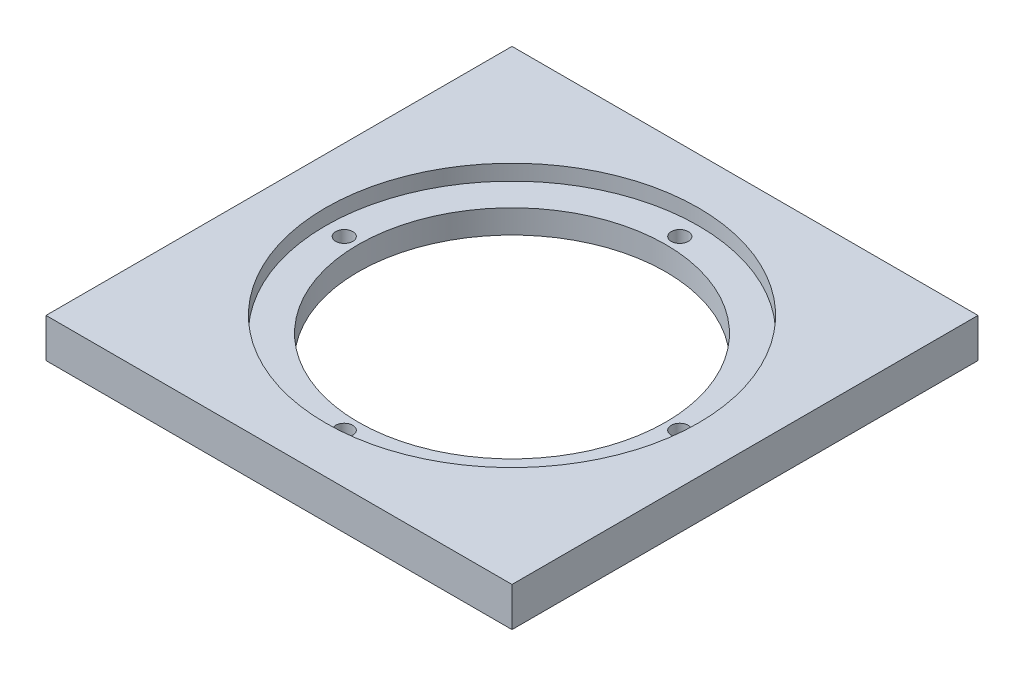
from build123d import *

# Parameters (mm, degrees)
SKETCH1_W               = 150
SKETCH1_H               = 150
SKETCH1_R               = 49.5
BOSS_EXTRUDE1_DEPTH     = 12.5984
SKETCH2_R               = 60
CUT_EXTRUDE1_DEPTH      = 5
CUT_EXTRUDE2_DEPTH      = 107.81160837
CUT_EXTRUDE2_DEPTH_BACK = 107.81160837
SKETCH3_R               = 2.75


with BuildPart() as part:
    # Sketch1 → Boss-Extrude1 (new body)
    with BuildSketch(Plane(origin=(0, 0, 0), x_dir=(1, 0, 0), z_dir=(0, 1, 0))):
        Rectangle(SKETCH1_W, SKETCH1_H)
        Circle(SKETCH1_R, mode=Mode.SUBTRACT)
    extrude(amount=-BOSS_EXTRUDE1_DEPTH)

    # Sketch2 → Cut-Extrude1 (cut)
    with BuildSketch(Plane(origin=(0, 0, 0), x_dir=(1, 0, 0), z_dir=(0, 1, 0))):
        Circle(SKETCH2_R)
    extrude(amount=-CUT_EXTRUDE1_DEPTH, mode=Mode.SUBTRACT)

    # Sketch3 → Cut-Extrude2 (cut, two sides: drawn at the far end of the back side and taken through both)
    with BuildSketch(Plane(origin=(0, 0, 0), x_dir=(1, 0, 0), z_dir=(0, 1, 0)).offset(-CUT_EXTRUDE2_DEPTH_BACK)):
        with Locations((-54, 0)):
            Circle(SKETCH3_R)
        with Locations((0, 54)):
            Circle(SKETCH3_R)
        with Locations((54, 0)):
            Circle(SKETCH3_R)
        with Locations((0, -54)):
            Circle(SKETCH3_R)
    extrude(amount=CUT_EXTRUDE2_DEPTH + CUT_EXTRUDE2_DEPTH_BACK, mode=Mode.SUBTRACT)


solid = part.part
